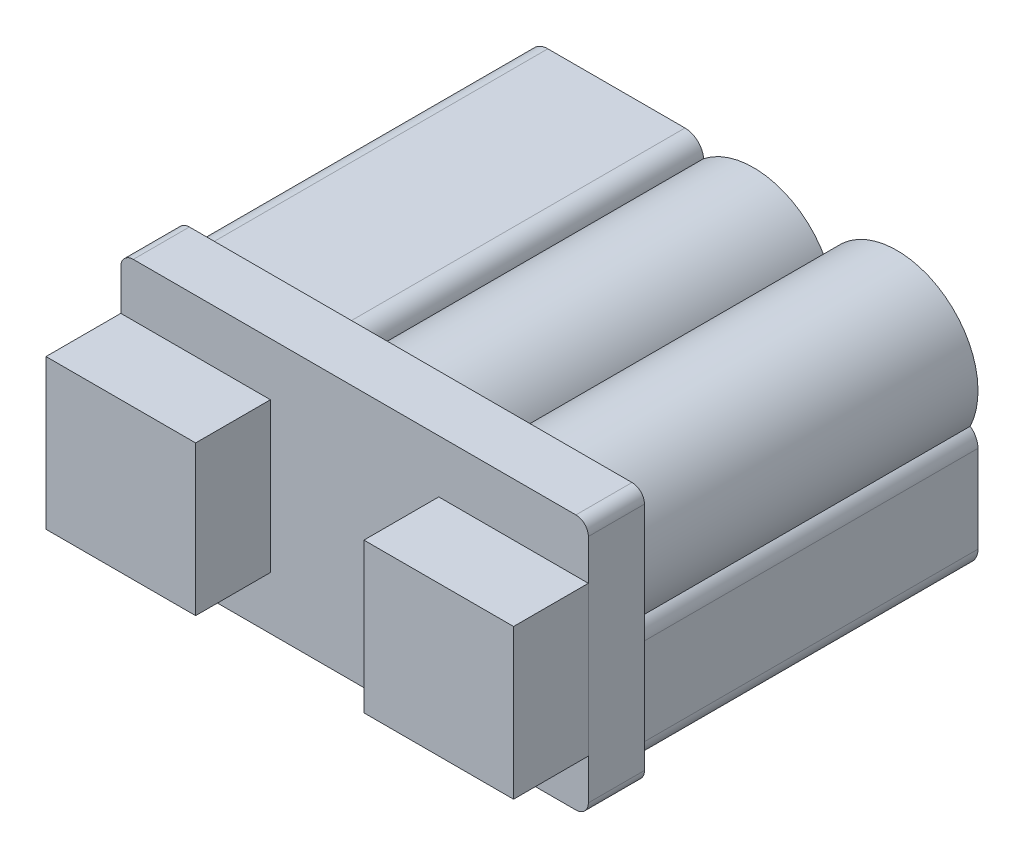
from build123d import *

# Parameters (mm, degrees)
SKETCH1_W                    = 238.125
SKETCH1_H                    = 130.175
BOSS_EXTRUDE1_DEPTH          = 203.2
SKETCH2_W                    = 238.125
SKETCH2_H                    = 130.175
CUT_EXTRUDE1_DEPTH           = 174.625
FILLET1_R                    = 6.35
TERMINAL_START               = -38.1
TERMINAL_CLEARANCE_OUTLINE_W = 76.2
TERMINAL_CLEARANCE_OUTLINE_H = 38.1
TERMINAL_CLEARANCE_DEPTH     = 76.2


# Read off the part's stored shape, not the designer's step: Terminal clearance
with BuildPart() as part:
    # Sketch1 → Boss-Extrude1 (new body)
    with BuildSketch(Plane.XY):
        Rectangle(SKETCH1_W, SKETCH1_H)
    extrude(amount=BOSS_EXTRUDE1_DEPTH)

    # Sketch2 → Cut-Extrude1 (cut)
    with BuildSketch(Plane(origin=(0, 0, 0), x_dir=(-1, 0, 0), z_dir=(0, 0, -1))):
        Rectangle(SKETCH2_W, SKETCH2_H)
        with BuildLine():
            ThreePointArc((114.3, -19.05), (82.938934322, -59.116688549), (36.5125, -38.297414599))
            ThreePointArc((36.5125, -38.297414599), (8.641725006, -59.410205821), (-25.430393972, -51.56031663))
            ThreePointArc((-25.430393972, -51.56031663), (-28.464210223, -57.798844223), (-34.925, -60.325))
            Line((-34.925, -60.325), (-104.775, -60.325))
            ThreePointArc((-104.775, -60.325), (-111.510192091, -57.535192091), (-114.3, -50.8))
            Line((-114.3, -50.8), (-114.3, -6.35))
            ThreePointArc((-114.3, -6.35), (-113.249567583, -2.001744111), (-110.329957107, 1.387446384))
            ThreePointArc((-110.329957107, 1.387446384), (-91.484237132, 55.967234316), (-36.5125, 38.297414599))
            ThreePointArc((-36.5125, 38.297414599), (-8.641725006, 59.410205821), (25.430393972, 51.56031663))
            ThreePointArc((25.430393972, 51.56031663), (28.464210223, 57.798844223), (34.925, 60.325))
            Line((34.925, 60.325), (104.775, 60.325))
            ThreePointArc((104.775, 60.325), (111.510192091, 57.535192091), (114.3, 50.8))
            Line((114.3, 50.8), (114.3, 6.35))
            ThreePointArc((114.3, 6.35), (113.249567583, 2.001744111), (110.329957107, -1.387446384))
            ThreePointArc((110.329957107, -1.387446384), (113.295260302, -9.998383558), (114.3, -19.05))
        make_face(mode=Mode.SUBTRACT)
    extrude(amount=-CUT_EXTRUDE1_DEPTH, mode=Mode.SUBTRACT)

    # Fillet1
    fillet1_edges = [part.edges().sort_by_distance(p)[0] for p in [
        (119.0625, -65.0875, 188.9125),
        (-119.0625, -65.0875, 188.9125),
        (-119.0625, 65.0875, 188.9125),
        (119.0625, 65.0875, 188.9125),
    ]]
    fillet(fillet1_edges, radius=FILLET1_R)


with BuildPart() as body_2:
    # Terminal clearance outline → Terminal clearance (new body)
    with BuildSketch(Plane(origin=(0, 0, 0), x_dir=(1, 0, 0), z_dir=(0, 1, 0)).offset(TERMINAL_START)):
        with Locations((-80.9625, -222.25)):
            Rectangle(TERMINAL_CLEARANCE_OUTLINE_W, TERMINAL_CLEARANCE_OUTLINE_H)
        with Locations((80.9625, -222.25)):
            Rectangle(TERMINAL_CLEARANCE_OUTLINE_W, TERMINAL_CLEARANCE_OUTLINE_H)
    extrude(amount=TERMINAL_CLEARANCE_DEPTH)


solid = Compound([part.part, body_2.part])
